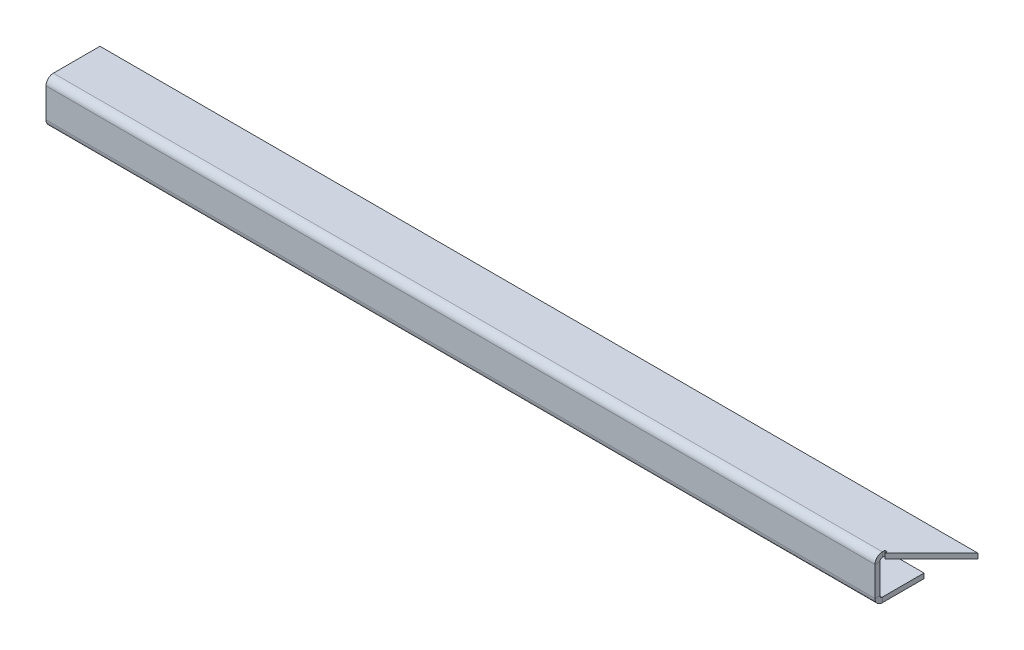
from build123d import *

# Parameters (mm, degrees)
BASE_FLANGE1_DEPTH            = 1
EDGE_FLANGE1_STRIP_W          = 5
EDGE_FLANGE1_STRIP_H          = 1
EDGE_FLANGE1_STRIP_CUT_DEPTH  = 169
EDGE_FLANGE1_RELIEF_W         = 5.5
EDGE_FLANGE1_RELIEF_H         = 0.5
EDGE_FLANGE1_RELIEF_CUT_DEPTH = 1
EDGE_FLANGE1_DEPTH            = 169
EDGE_FLANGE2_STRIP_W          = 5
EDGE_FLANGE2_STRIP_H          = 1
EDGE_FLANGE2_STRIP_CUT_DEPTH  = 169
EDGE_FLANGE2_DEPTH            = 169
SKETCH12_R                    = 1.5
CUT_EXTRUDE1_DEPTH            = 3


# Sheet-metal steps are written as plain solids
with BuildPart() as part:
    # Sketch1 → Base-Flange1 (new body)
    with BuildSketch(Plane(origin=(0, 0, 0), x_dir=(1, 0, 0), z_dir=(0, 1, 0))):
        Polygon((-84.5, 0), (84.5, 0), (94.5, 10), (-84.5, 10), align=None)
    extrude(amount=-BASE_FLANGE1_DEPTH)

    # Edge-Flange1 strip (across the edge) → Edge-Flange1 strip cut (cut)
    with BuildSketch(Plane(origin=(84.5, -1, 0), x_dir=(0, 0, -1), z_dir=(-1, 0, 0))):
        with Locations((-2, -0.5)):
            Rectangle(EDGE_FLANGE1_STRIP_W, EDGE_FLANGE1_STRIP_H)
    extrude(amount=EDGE_FLANGE1_STRIP_CUT_DEPTH, mode=Mode.SUBTRACT)

    # Edge-Flange1 relief (on the sheet) → Edge-Flange1 relief cut (cut)
    with BuildSketch(Plane(origin=(84.5, -1, -0.5), x_dir=(0, 0, -1), z_dir=(0, -1, 0))):
        with Locations((-2.25, 0.25)):
            Rectangle(EDGE_FLANGE1_RELIEF_W, EDGE_FLANGE1_RELIEF_H)
    extrude(amount=-EDGE_FLANGE1_RELIEF_CUT_DEPTH, mode=Mode.SUBTRACT)

    # Edge-Flange1 section (across the edge) → Edge-Flange1 (add)
    with BuildSketch(Plane(origin=(84.5, -1, 0), x_dir=(0, 0, -1), z_dir=(-1, 0, 0))):
        with BuildLine():
            Line((-1, 0.5), (-1, 7))
            Line((-1, 7), (0, 7))
            Line((0, 7), (0, 0.5))
            ThreePointArc((0, 0.5), (0.146446609, 0.146446609), (0.5, 0))
            Line((0.5, 0), (0.5, -1))
            ThreePointArc((0.5, -1), (-0.560660172, -0.560660172), (-1, 0.5))
        make_face()
    extrude(amount=EDGE_FLANGE1_DEPTH)

    # Edge-Flange2 strip (across the edge) → Edge-Flange2 strip cut (cut)
    with BuildSketch(Plane(origin=(84.5, -8, 0), x_dir=(0, 1, 0), z_dir=(-1, 0, 0))):
        with Locations((-2, -0.5)):
            Rectangle(EDGE_FLANGE2_STRIP_W, EDGE_FLANGE2_STRIP_H)
    extrude(amount=EDGE_FLANGE2_STRIP_CUT_DEPTH, mode=Mode.SUBTRACT)

    # Edge-Flange2 section (across the edge) → Edge-Flange2 (add)
    with BuildSketch(Plane(origin=(84.5, -8, 0), x_dir=(0, 1, 0), z_dir=(-1, 0, 0))):
        with BuildLine():
            Line((-1, 0.5), (-1, 9))
            Line((-1, 9), (0, 9))
            Line((0, 9), (0, 0.5))
            ThreePointArc((0, 0.5), (0.146446609, 0.146446609), (0.5, 0))
            Line((0.5, 0), (0.5, -1))
            ThreePointArc((0.5, -1), (-0.560660172, -0.560660172), (-1, 0.5))
        make_face()
    extrude(amount=EDGE_FLANGE2_DEPTH)

    # Sketch12 → Cut-Extrude1 (cut)
    with BuildSketch(Plane.XZ.offset(9)):
        with Locations(Location((-74.5, -5, 0), (0, 0, 270))):
            Circle(SKETCH12_R)
        with Locations(Location((0, -5, 0), (0, 0, 270))):
            Circle(SKETCH12_R)
        with Locations(Location((74.5, -5, 0), (0, 0, 270))):
            Circle(SKETCH12_R)
    extrude(amount=-CUT_EXTRUDE1_DEPTH, mode=Mode.SUBTRACT)


solid = part.part
